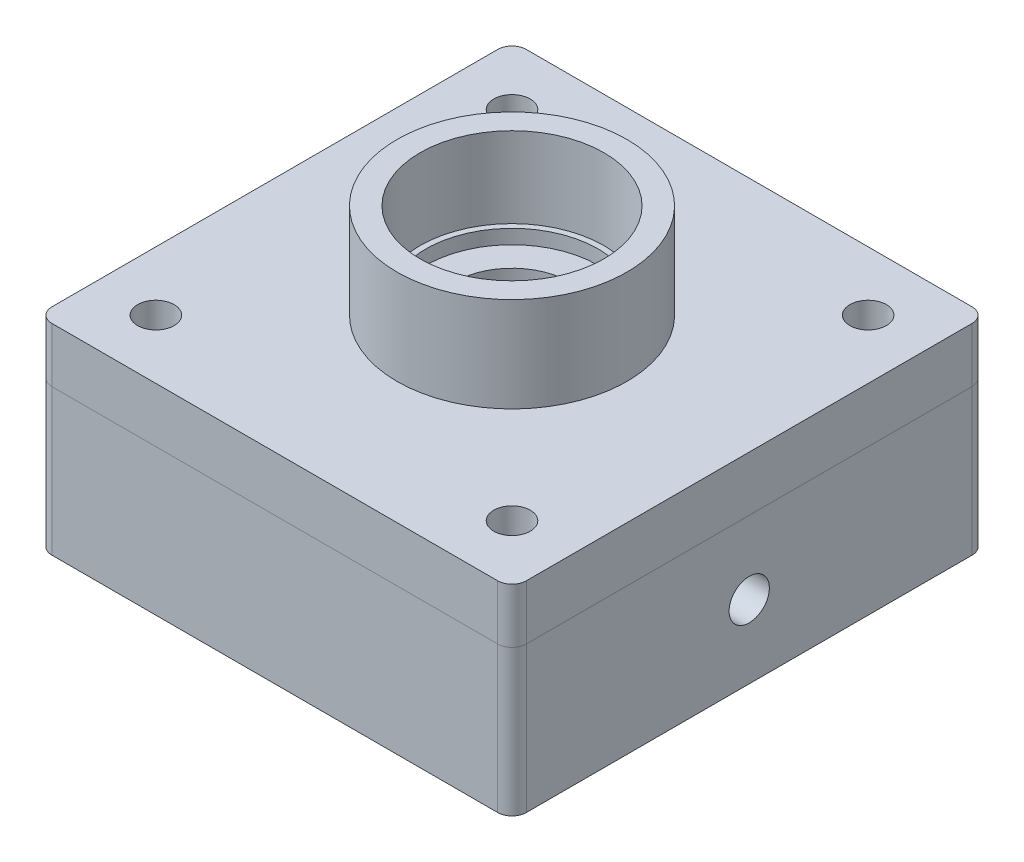
from build123d import *

# Parameters (mm, degrees)
SKETCH1_W           = 165.1
SKETCH1_H           = 165.1
SKETCH1_R           = 6.35
BOSS_EXTRUDE1_DEPTH = 50.8
SKETCH3_R           = 20
CUT_EXTRUDE1_DEPTH  = 200
SKETCH4_R           = 7
CUT_EXTRUDE2_DEPTH  = 74.83
CUT_EXTRUDE3_START  = -52
CUT_EXTRUDE3_DEPTH  = 23.654240545
FILLET1_R           = 5
SKETCH6_R           = 76.2
SKETCH6_R_2         = 69.85
CUT_EXTRUDE4_DEPTH  = 8
BOSS_EXTRUDE3_START = 50.8
SKETCH1_2_W         = 165.1
SKETCH1_2_H         = 165.1
SKETCH1_2_R         = 6.35
BOSS_EXTRUDE3_DEPTH = 19.05
FILLET2_R           = 5
BOSS_EXTRUDE4_START = 19.05
SKETCH7_R           = 40
SKETCH7_R_2         = 32
SKETCH7_R_3         = 30
BOSS_EXTRUDE4_DEPTH = 32.95
CUT_EXTRUDE5_START  = 24
SKETCH7_3_R         = 32
SKETCH7_3_R_2       = 30
CUT_EXTRUDE5_DEPTH  = 28
SKETCH3_2_R         = 20
CUT_EXTRUDE6_DEPTH  = 156.55335103


with BuildPart() as part:
    # Sketch1 → Boss-Extrude1 (new body)
    with BuildSketch(Plane(origin=(0, 0, 0), x_dir=(1, 0, 0), z_dir=(0, 1, 0))):
        Rectangle(SKETCH1_W, SKETCH1_H)
        with Locations(Location((-61.963767235, 61.963767235, 0), (0, 0, 270))):
            Circle(SKETCH1_R, mode=Mode.SUBTRACT)
        with Locations(Location((61.963767235, 61.963767235, 0), (0, 0, 270))):
            Circle(SKETCH1_R, mode=Mode.SUBTRACT)
        with Locations(Location((61.963767235, -61.963767235, 0), (0, 0, 270))):
            Circle(SKETCH1_R, mode=Mode.SUBTRACT)
        with Locations(Location((-61.963767235, -61.963767235, 0), (0, 0, 270))):
            Circle(SKETCH1_R, mode=Mode.SUBTRACT)
    extrude(amount=BOSS_EXTRUDE1_DEPTH)

    # Sketch3 → Cut-Extrude1 (cut)
    with BuildSketch(Plane.XZ):
        with Locations(Location((0, 0, 0), (0, 0, 270))):
            Circle(SKETCH3_R)
    extrude(amount=-CUT_EXTRUDE1_DEPTH, mode=Mode.SUBTRACT)

    # Sketch4 → Cut-Extrude2 (cut)
    with BuildSketch(Plane(origin=(82.55, 0, 0), x_dir=(0, 0, -1), z_dir=(1, 0, 0))):
        with Locations((0, 25.4)):
            Circle(SKETCH4_R)
    extrude(amount=-CUT_EXTRUDE2_DEPTH, mode=Mode.SUBTRACT)

    # Cut-Extrude3: read off the stored shape, not the designer's step
    # Cut-Extrude3 outline → Cut-Extrude3 (cut)
    with BuildSketch(Plane(origin=(0, 50.8, 0), x_dir=(1, 0, 0), z_dir=(0, 1, 0)).offset(CUT_EXTRUDE3_START)):
        with BuildLine():
            add(Edge.make_bspline(
                [(50.55, -6.35), (51.47422126, -6.35), (52.302466674, -6.153856691), (53.750900163, -5.540336611), (54.377469866, -5.126654902), (55.505405632, -4.046735856), (55.989700628, -3.386313597), (56.692940175, -1.822566515), (56.897346558, -0.923572623), (56.902599966, 0.886717767), (56.699688489, 1.798962244), (56.004003016, 3.362853664), (55.518127515, 4.030235701), (54.400965604, 5.108341681), (53.760643664, 5.533511906), (52.329554982, 6.145011865), (51.480571337, 6.347463595), (50.110922006, 6.351232148), (49.655780423, 6.301077578), (48.823880157, 6.125660583), (48.443917363, 6.00347472), (47.356446167, 5.544626686), (46.727263651, 5.130170088), (45.598462304, 4.051448232), (45.112857079, 3.390908719), (44.407214336, 1.82399818), (44.202597079, 0.923991808), (44.197454079, -0.88794427), (44.40080252, -1.801200354), (45.098290108, -3.366869707), (45.585297177, -4.034583157), (46.704472395, -5.112538783), (47.346247575, -5.537622225), (48.779720786, -6.147796435), (49.62577874, -6.35), (50.55, -6.35)],
                knots=[0, 0, 0, 0, 0.0625, 0.0625, 0.125, 0.125, 0.1875, 0.1875, 0.25, 0.25, 0.3125, 0.3125, 0.375, 0.375, 0.4375, 0.4375, 0.5, 0.5, 0.53125, 0.53125, 0.5625, 0.5625, 0.625, 0.625, 0.6875, 0.6875, 0.75, 0.75, 0.8125, 0.8125, 0.875, 0.875, 0.9375, 0.9375, 1, 1, 1, 1], degree=3))
        make_face()
    extrude(amount=CUT_EXTRUDE3_DEPTH, mode=Mode.SUBTRACT)

    # Fillet1
    fillet1_edges = [part.edges().sort_by_distance(p)[0] for p in [
        (82.55, 25.4, 82.55),
        (-82.55, 25.4, 82.55),
        (-82.55, 25.4, -82.55),
        (82.55, 25.4, -82.55),
    ]]
    fillet(fillet1_edges, radius=FILLET1_R)

    # Sketch6 → Cut-Extrude4 (cut)
    with BuildSketch(Plane.XZ):
        with Locations(Location((0, 0, 0), (0, 0, 270))):
            Circle(SKETCH6_R)
        with Locations(Location((0, 0, 0), (0, 0, 270))):
            Circle(SKETCH6_R_2, mode=Mode.SUBTRACT)
    extrude(amount=-CUT_EXTRUDE4_DEPTH, mode=Mode.SUBTRACT)


with BuildPart() as body_2:
    # Sketch1<2> → Boss-Extrude3 (new body)
    with BuildSketch(Plane(origin=(0, 0, 0), x_dir=(1, 0, 0), z_dir=(0, 1, 0)).offset(BOSS_EXTRUDE3_START)):
        Rectangle(SKETCH1_2_W, SKETCH1_2_H)
        with Locations(Location((-61.963767235, 61.963767235, 0), (0, 0, 90))):
            Circle(SKETCH1_2_R, mode=Mode.SUBTRACT)
        with Locations(Location((61.963767235, 61.963767235, 0), (0, 0, 90))):
            Circle(SKETCH1_2_R, mode=Mode.SUBTRACT)
        with Locations(Location((61.963767235, -61.963767235, 0), (0, 0, 90))):
            Circle(SKETCH1_2_R, mode=Mode.SUBTRACT)
        with Locations(Location((-61.963767235, -61.963767235, 0), (0, 0, 90))):
            Circle(SKETCH1_2_R, mode=Mode.SUBTRACT)
    extrude(amount=BOSS_EXTRUDE3_DEPTH)

    # Fillet2
    fillet2_edges = [body_2.edges().sort_by_distance(p)[0] for p in [
        (-82.55, 60.325, 82.55),
        (82.55, 60.325, 82.55),
        (82.55, 60.325, -82.55),
        (-82.55, 60.325, -82.55),
    ]]
    fillet(fillet2_edges, radius=FILLET2_R)

    # Sketch7 → Boss-Extrude4 (add)
    # profile 1 of 2: a face of its own
    with BuildSketch(Plane(origin=(0, 50.8, 0), x_dir=(1, 0, 0), z_dir=(0, 1, 0)).offset(BOSS_EXTRUDE4_START)):
        with Locations(Location((0, 0, 0), (0, 0, 90))):
            Circle(SKETCH7_R)
        Circle(SKETCH7_R_2, mode=Mode.SUBTRACT)
    # profile 2 of 2: a face of its own
    with BuildSketch(Plane(origin=(0, 50.8, 0), x_dir=(1, 0, 0), z_dir=(0, 1, 0)).offset(BOSS_EXTRUDE4_START)):
        Circle(SKETCH7_R_2)
        with Locations(Location((0, 0, 0), (0, 0, 90))):
            Circle(SKETCH7_R_3, mode=Mode.SUBTRACT)
    extrude(amount=BOSS_EXTRUDE4_DEPTH)

    # Sketch7<3> → Cut-Extrude5 (cut)
    with BuildSketch(Plane(origin=(0, 50.8, 0), x_dir=(1, 0, 0), z_dir=(0, 1, 0)).offset(CUT_EXTRUDE5_START)):
        with Locations(Location((0, 0, 0), (0, 0, 270))):
            Circle(SKETCH7_3_R)
        with Locations(Location((0, 0, 0), (0, 0, 90))):
            Circle(SKETCH7_3_R_2, mode=Mode.SUBTRACT)
    extrude(amount=CUT_EXTRUDE5_DEPTH, mode=Mode.SUBTRACT)

    # Sketch3<2> → Cut-Extrude6 (cut, through all)
    with BuildSketch(Plane.XZ):
        with Locations(Location((0, 0, 0), (0, 0, 270))):
            Circle(SKETCH3_2_R)
    extrude(amount=-CUT_EXTRUDE6_DEPTH, mode=Mode.SUBTRACT)


solid = Compound([part.part, body_2.part])
